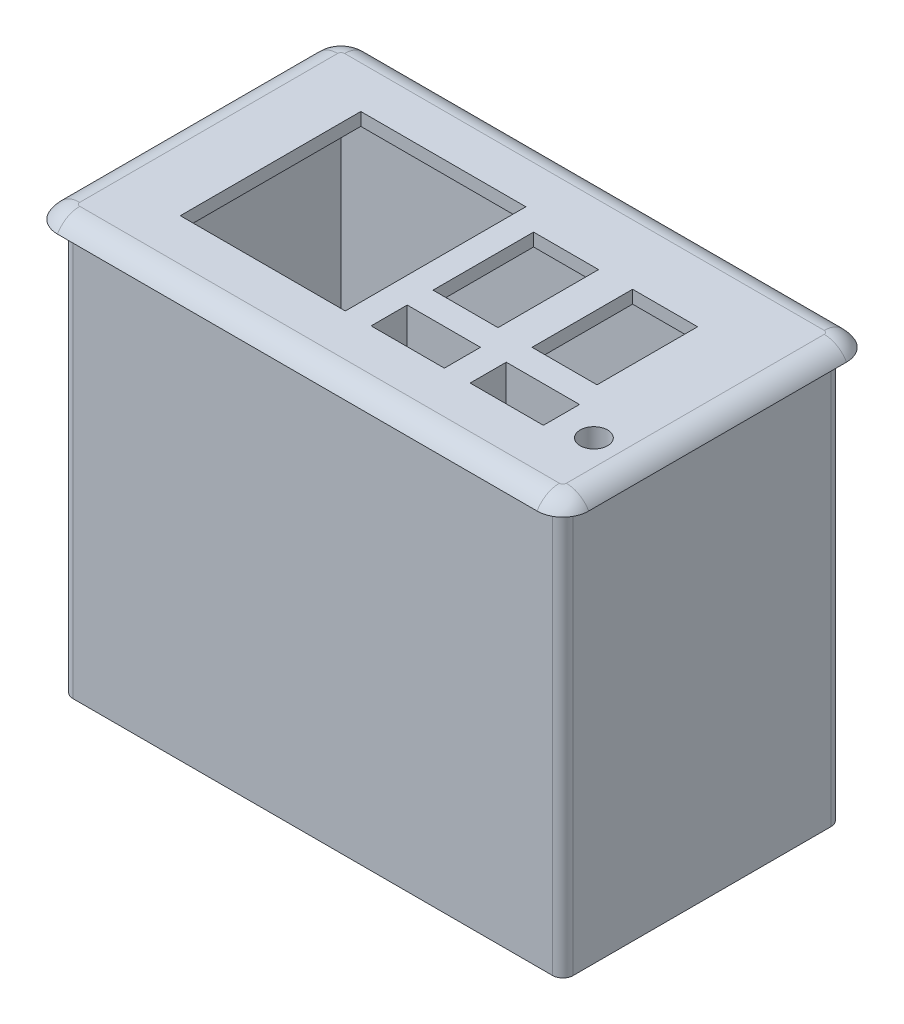
from build123d import *

# Parameters (mm, degrees)
BOSS_EXTRUDE1_DEPTH = 2.5
FILLET1_R           = 5
SKETCH2_W           = 93
SKETCH2_H           = 50
BOSS_EXTRUDE2_DEPTH = 77
SKETCH8_R           = 2.660141884
SKETCH8_W           = 32
SKETCH8_H           = 35
SKETCH8_W_2         = 14.2
SKETCH8_H_2         = 7
SKETCH8_W_3         = 12.6
SKETCH8_H_3         = 19.5
CUT_EXTRUDE3_DEPTH  = 10
BOSS_EXTRUDE4_START = 5
SKETCH9_R           = 3.660141884
SKETCH9_R_2         = 2.660141884
SKETCH9_W           = 16.2
SKETCH9_H           = 9
SKETCH9_W_2         = 14.2
SKETCH9_H_2         = 7
BOSS_EXTRUDE4_DEPTH = 5
SKETCH10_W          = 5
SKETCH10_H          = 5
BOSS_EXTRUDE5_DEPTH = 10
SKETCH11_W          = 93
SKETCH11_H          = 50
BOSS_EXTRUDE6_DEPTH = 2.5
CUT_EXTRUDE4_REACH  = 101.36
SKETCH12_R          = 1.15


with BuildPart() as part:
    # Sketch1 → Boss-Extrude1 (new body)
    with BuildSketch(Plane(origin=(0, 0, 0), x_dir=(1, 0, 0), z_dir=(0, 1, 0))):
        with BuildLine():
            Line((-46.5, 30), (46.5, 30))
            ThreePointArc((46.5, 30), (50.035533906, 28.535533906), (51.5, 25))
            Line((51.5, 25), (51.5, -25))
            ThreePointArc((51.5, -25), (50.035533906, -28.535533906), (46.5, -30))
            Line((46.5, -30), (-46.5, -30))
            ThreePointArc((-46.5, -30), (-50.035533906, -28.535533906), (-51.5, -25))
            Line((-51.5, -25), (-51.5, 25))
            ThreePointArc((-51.5, 25), (-50.035533906, 28.535533906), (-46.5, 30))
        make_face()
    extrude(amount=BOSS_EXTRUDE1_DEPTH)

    # Fillet1
    # the kernel refuses this fillet: 5 mm, written as the material it takes off along each edge
    with BuildSketch(Plane(origin=(-46.5, 2.5, -25), x_dir=(-1, 0, 0), z_dir=(0, 0, 1))) as fillet1_piece_1:
        with BuildLine():
            CenterArc((0.669872981, 5), FILLET1_R, 270, 60)
            Line((0.669872981, 0), (0.669872981, -0.1))
            Line((0.669872981, -0.1), (5, -0.1))
            Line((5, -0.1), (5.1, 0))
            ThreePointArc((5.1, 0), (5.1, 1.25), (5.08660254, 2.45))
            Line((5.08660254, 2.45), (5, 2.5))
        make_face()
    revolve(axis=Axis((-46.5, 2.5, -25), (0, -1, 0)), revolution_arc=90, mode=Mode.SUBTRACT)
    with BuildSketch(Plane(origin=(-46.5, 2.5, -30), x_dir=(0, -1, 0), z_dir=(1, 0, 0)), Plane(origin=(46.5, 2.5, 30), x_dir=(0, -1, 0), z_dir=(-1, 0, 0))) as fillet1_piece_2:
        with BuildLine():
            CenterArc((5, -4.330127019), FILLET1_R, 120, 60)
            Line((0, -4.330127019), (-0.1, -4.330127019))
            Line((-0.1, -4.330127019), (-0.1, 0))
            Line((-0.1, 0), (0, 0.1))
            ThreePointArc((0, 0.1), (1.25, 0.1), (2.45, 0.08660254))
            Line((2.45, 0.08660254), (2.5, 0))
        make_face()
    extrude(amount=93, mode=Mode.SUBTRACT)
    with BuildSketch(Plane(origin=(46.5, 2.5, -25), x_dir=(0, 0, -1), z_dir=(-1, 0, 0))) as fillet1_piece_3:
        with BuildLine():
            CenterArc((0.669872981, 5), FILLET1_R, 270, 60)
            Line((0.669872981, 0), (0.669872981, -0.1))
            Line((0.669872981, -0.1), (5, -0.1))
            Line((5, -0.1), (5.1, 0))
            ThreePointArc((5.1, 0), (5.1, 1.25), (5.08660254, 2.45))
            Line((5.08660254, 2.45), (5, 2.5))
        make_face()
    revolve(axis=Axis((46.5, 2.5, -25), (0, -1, 0)), revolution_arc=90, mode=Mode.SUBTRACT)
    with BuildSketch(Plane(origin=(51.5, 2.5, -25), x_dir=(0, -1, 0), z_dir=(0, 0, 1)), Plane(origin=(-51.5, 2.5, 25), x_dir=(0, -1, 0), z_dir=(0, 0, -1))) as fillet1_piece_4:
        with BuildLine():
            CenterArc((5, -4.330127019), FILLET1_R, 120, 60)
            Line((0, -4.330127019), (-0.1, -4.330127019))
            Line((-0.1, -4.330127019), (-0.1, 0))
            Line((-0.1, 0), (0, 0.1))
            ThreePointArc((0, 0.1), (1.25, 0.1), (2.45, 0.08660254))
            Line((2.45, 0.08660254), (2.5, 0))
        make_face()
    extrude(amount=50, mode=Mode.SUBTRACT)
    with BuildSketch(Plane(origin=(46.5, 2.5, 25), x_dir=(1, 0, 0), z_dir=(0, 0, -1))) as fillet1_piece_5:
        with BuildLine():
            CenterArc((0.669872981, 5), FILLET1_R, 270, 60)
            Line((0.669872981, 0), (0.669872981, -0.1))
            Line((0.669872981, -0.1), (5, -0.1))
            Line((5, -0.1), (5.1, 0))
            ThreePointArc((5.1, 0), (5.1, 1.25), (5.08660254, 2.45))
            Line((5.08660254, 2.45), (5, 2.5))
        make_face()
    revolve(axis=Axis((46.5, 2.5, 25), (0, -1, 0)), revolution_arc=90, mode=Mode.SUBTRACT)
    with BuildSketch(Plane(origin=(-46.5, 2.5, 25), x_dir=(0, 0, 1), z_dir=(1, 0, 0))) as fillet1_piece_6:
        with BuildLine():
            CenterArc((0.669872981, 5), FILLET1_R, 270, 60)
            Line((0.669872981, 0), (0.669872981, -0.1))
            Line((0.669872981, -0.1), (5, -0.1))
            Line((5, -0.1), (5.1, 0))
            ThreePointArc((5.1, 0), (5.1, 1.25), (5.08660254, 2.45))
            Line((5.08660254, 2.45), (5, 2.5))
        make_face()
    revolve(axis=Axis((-46.5, 2.5, 25), (0, -1, 0)), revolution_arc=90, mode=Mode.SUBTRACT)

    # Sketch2 → Boss-Extrude2 (add)
    with BuildSketch(Plane.XZ):
        with BuildLine():
            Line((48.5, -25), (48.5, 25))
            ThreePointArc((48.5, 25), (47.914213562, 26.414213562), (46.5, 27))
            Line((46.5, 27), (-46.5, 27))
            ThreePointArc((-46.5, 27), (-47.914213562, 26.414213562), (-48.5, 25))
            Line((-48.5, 25), (-48.5, -25))
            ThreePointArc((-48.5, -25), (-47.914213562, -26.414213562), (-46.5, -27))
            Line((-46.5, -27), (46.5, -27))
            ThreePointArc((46.5, -27), (47.914213562, -26.414213562), (48.5, -25))
        make_face()
        Rectangle(SKETCH2_W, SKETCH2_H, mode=Mode.SUBTRACT)
    extrude(amount=BOSS_EXTRUDE2_DEPTH)

    # Sketch8 → Cut-Extrude3 (cut)
    with BuildSketch(Plane.XZ):
        with Locations(Location((42.218517518, 14.706886542, 0), (0, 0, 270))):
            Circle(SKETCH8_R)
        with Locations((-19.181482482, 0)):
            Rectangle(SKETCH8_W, SKETCH8_H)
        with Locations((8.918517518, 14)):
            Rectangle(SKETCH8_W_2, SKETCH8_H_2)
        with Locations((28.118517518, 14)):
            Rectangle(SKETCH8_W_2, SKETCH8_H_2)
        with Locations((8.118517518, -4.25)):
            Rectangle(SKETCH8_W_3, SKETCH8_H_3)
        with Locations((27.318517518, -4.25)):
            Rectangle(SKETCH8_W_3, SKETCH8_H_3)
    extrude(amount=-CUT_EXTRUDE3_DEPTH, mode=Mode.SUBTRACT)

    # Sketch9 → Boss-Extrude4 (add)
    # profile 1 of 3: a face of its own
    with BuildSketch(Plane.XZ.offset(BOSS_EXTRUDE4_START)):
        with Locations(Location((42.218517518, 14.706886542, 0), (0, 0, 90))):
            Circle(SKETCH9_R)
        with Locations(Location((42.218517518, 14.706886542, 0), (0, 0, 270))):
            Circle(SKETCH9_R_2, mode=Mode.SUBTRACT)
    # profile 2 of 3: a face of its own
    with BuildSketch(Plane.XZ.offset(BOSS_EXTRUDE4_START)):
        with Locations((8.918517518, 14)):
            Rectangle(SKETCH9_W, SKETCH9_H)
        with Locations((8.918517518, 14)):
            Rectangle(SKETCH9_W_2, SKETCH9_H_2, mode=Mode.SUBTRACT)
    # profile 3 of 3: a face of its own
    with BuildSketch(Plane.XZ.offset(BOSS_EXTRUDE4_START)):
        with Locations((28.118517518, 14)):
            Rectangle(SKETCH9_W, SKETCH9_H)
        with Locations((28.118517518, 14)):
            Rectangle(SKETCH9_W_2, SKETCH9_H_2, mode=Mode.SUBTRACT)
    extrude(amount=-BOSS_EXTRUDE4_DEPTH)

    # Sketch10 → Boss-Extrude5 (add)
    with BuildSketch(Plane.XZ.offset(77)):
        with Locations((44, 22.5)):
            Rectangle(SKETCH10_W, SKETCH10_H)
        with Locations((-44, 22.5)):
            Rectangle(SKETCH10_W, SKETCH10_H)
        with Locations((-44, -22.5)):
            Rectangle(SKETCH10_W, SKETCH10_H)
        with Locations((44, -22.5)):
            Rectangle(SKETCH10_W, SKETCH10_H)
    extrude(amount=-BOSS_EXTRUDE5_DEPTH)

    # Sketch11 → Boss-Extrude6 (add)
    with BuildSketch(Plane.XZ.offset(77)):
        with BuildLine():
            Line((46.5, 27), (-46.5, 27))
            ThreePointArc((-46.5, 27), (-47.914213562, 26.414213562), (-48.5, 25))
            Line((-48.5, 25), (-48.5, -25))
            ThreePointArc((-48.5, -25), (-47.914213562, -26.414213562), (-46.5, -27))
            Line((-46.5, -27), (46.5, -27))
            ThreePointArc((46.5, -27), (47.914213562, -26.414213562), (48.5, -25))
            Line((48.5, -25), (48.5, 25))
            ThreePointArc((48.5, 25), (47.914213562, 26.414213562), (46.5, 27))
        make_face()
        Rectangle(SKETCH11_W, SKETCH11_H, mode=Mode.SUBTRACT)
    extrude(amount=BOSS_EXTRUDE6_DEPTH)

    # Sketch12 → Cut-Extrude4 (cut, up to next)
    with BuildSketch(Plane.XZ.offset(77), mode=Mode.PRIVATE) as cut_extrude4_sk1:
        with Locations(Location((-44, 22.5, 0), (0, 0, 270))):
            Circle(SKETCH12_R)
    cut_extrude4_tool1 = extrude(cut_extrude4_sk1.sketch, amount=-CUT_EXTRUDE4_REACH, mode=Mode.PRIVATE) & part.part
    # Sketch12 → Cut-Extrude4 (cut, up to next)
    with BuildSketch(Plane.XZ.offset(77), mode=Mode.PRIVATE) as cut_extrude4_sk2:
        with Locations(Location((44, 22.5, 0), (0, 0, 270))):
            Circle(SKETCH12_R)
    cut_extrude4_tool2 = extrude(cut_extrude4_sk2.sketch, amount=-CUT_EXTRUDE4_REACH, mode=Mode.PRIVATE) & part.part
    # Sketch12 → Cut-Extrude4 (cut, up to next)
    with BuildSketch(Plane.XZ.offset(77), mode=Mode.PRIVATE) as cut_extrude4_sk3:
        with Locations(Location((44, -22.5, 0), (0, 0, 270))):
            Circle(SKETCH12_R)
    cut_extrude4_tool3 = extrude(cut_extrude4_sk3.sketch, amount=-CUT_EXTRUDE4_REACH, mode=Mode.PRIVATE) & part.part
    # Sketch12 → Cut-Extrude4 (cut, up to next)
    with BuildSketch(Plane.XZ.offset(77), mode=Mode.PRIVATE) as cut_extrude4_sk4:
        with Locations(Location((-44, -22.5, 0), (0, 0, 270))):
            Circle(SKETCH12_R)
    cut_extrude4_tool4 = extrude(cut_extrude4_sk4.sketch, amount=-CUT_EXTRUDE4_REACH, mode=Mode.PRIVATE) & part.part
    add(cut_extrude4_tool1.solids().sort_by_distance((-44, -77, 22.5))[0], mode=Mode.SUBTRACT)
    add(cut_extrude4_tool2.solids().sort_by_distance((44, -77, 22.5))[0], mode=Mode.SUBTRACT)
    add(cut_extrude4_tool3.solids().sort_by_distance((44, -77, -22.5))[0], mode=Mode.SUBTRACT)
    add(cut_extrude4_tool4.solids().sort_by_distance((-44, -77, -22.5))[0], mode=Mode.SUBTRACT)


solid = part.part
